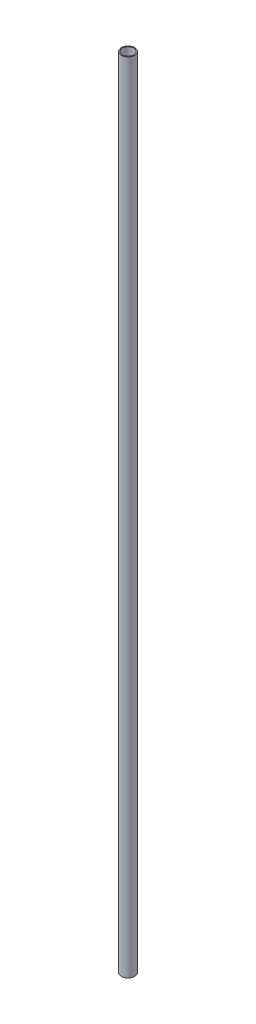
from build123d import *

# Parameters (mm, degrees)
SKETCH1_R           = 7.5
SKETCH1_R_2         = 6.5
BOSS_EXTRUDE1_DEPTH = 890


with BuildPart() as part:
    # Sketch1 → Boss-Extrude1 (new body)
    with BuildSketch(Plane(origin=(0, 0, 0), x_dir=(1, 0, 0), z_dir=(0, 1, 0))):
        Circle(SKETCH1_R)
        Circle(SKETCH1_R_2, mode=Mode.SUBTRACT)
    extrude(amount=-BOSS_EXTRUDE1_DEPTH)


solid = part.part
